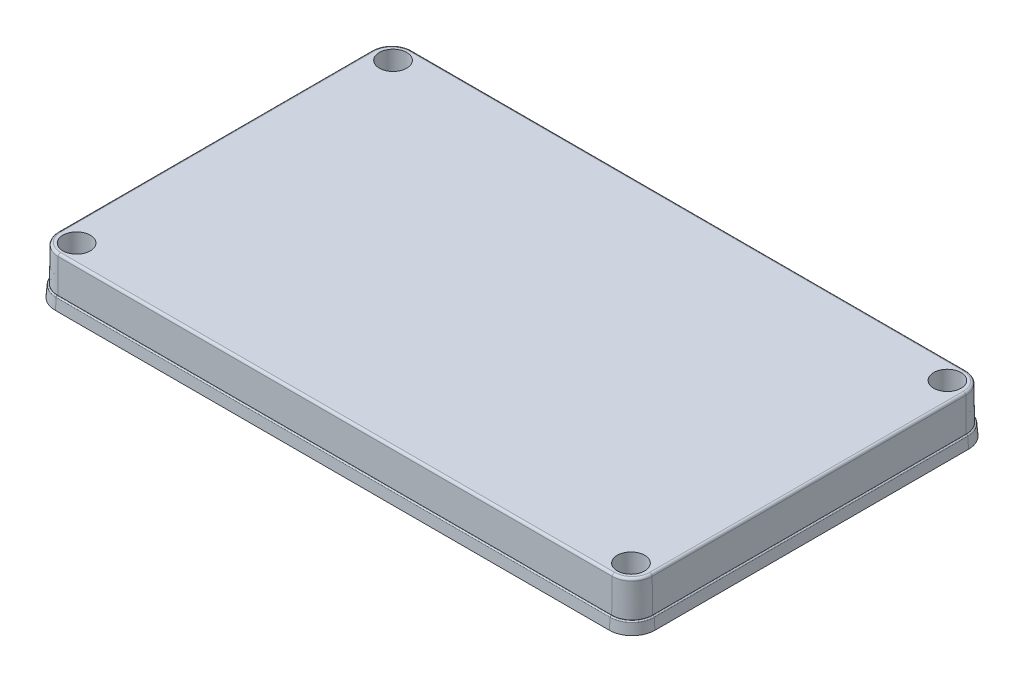
from build123d import *

# Parameters (mm, degrees)
MAIN_BODY_DEPTH                              = 20
TOP_START                                    = -15
TOP_CUT_DEPTH                                = 15
SKETCH3_R                                    = 5.75
COUNTER_BORE_DEPTH                           = 16
CAPTIVE_SCREW_SLIDE_IN_PROFILE_DEPTH         = 11
BOTTOM_START                                 = -2.5
BOTTOM_POCKET_CAPTIVE_SCREW_AREA_DEPTH       = 2.5
CAPTIVE_SCREW_FEATURE_VERTICAL_MIRROR_CO_R   = 5.75
CAPTIVE_SCREW_FEATURE_VERTICAL_MIRRO_2_DEPTH = 16
CAPTIVE_SCREW_FEATURE_VERTICAL_MIRRO_4_DEPTH = 11
CAPTIVE_START                                = -2.5
CAPTIVE_SCREW_FEATURE_VERTICAL_MIRRO_6_DEPTH = 2.5
O_RING_QUARTER_PROFILE_DEPTH                 = 2.7
O_RING_OUTER_FILLETS_R                       = 2
O_RING_INNER_FILLETS_R                       = 1.5
O_RING_OUTER_FILLETS_OF_OQP_HM_R             = 2
O_RING_INNER_FILLETS_OF_OQP_HM_R             = 1.5
OQP_VM_DEPTH                                 = 2.7
LID_POCKET_DEPTH                             = 17
OUTER_TOP_ANGLE                              = 0.795570135
OUTER_BOTTOM_ANGLE                           = -4.39870536
BOTTOM_HALF_OF_LID_R                         = 0.5
TOP_OF_LID_R                                 = 1


# Read off the part's stored shape, not the designer's step: OQP VM
with BuildPart() as part:
    # Sketch1 → MAIN BODY (new body)
    with BuildSketch(Plane(origin=(0, 0, 0), x_dir=(1, 0, 0), z_dir=(0, 1, 0))):
        with BuildLine():
            Line((116.4, -75.5), (-116.4, -75.5))
            ThreePointArc((-116.4, -75.5), (-123.188225099, -72.688225099), (-126, -65.9))
            Line((-126, -65.9), (-126, 65.9))
            ThreePointArc((-126, 65.9), (-123.188225099, 72.688225099), (-116.4, 75.5))
            Line((-116.4, 75.5), (116.4, 75.5))
            ThreePointArc((116.4, 75.5), (123.188225099, 72.688225099), (126, 65.9))
            Line((126, 65.9), (126, -65.9))
            ThreePointArc((126, -65.9), (123.188225099, -72.688225099), (116.4, -75.5))
        make_face()
    extrude(amount=MAIN_BODY_DEPTH)

    # Sketch2 → TOP CUT (cut)
    with BuildSketch(Plane(origin=(0, 20, 0), x_dir=(1, 0, 0), z_dir=(0, 1, 0)).offset(TOP_START)):
        with BuildLine():
            Line((-116.4, -75.5), (116.4, -75.5))
            ThreePointArc((116.4, -75.5), (123.188225099, -72.688225099), (126, -65.9))
            Line((126, -65.9), (126, 65.9))
            ThreePointArc((126, 65.9), (123.188225099, 72.688225099), (116.4, 75.5))
            Line((116.4, 75.5), (-116.4, 75.5))
            ThreePointArc((-116.4, 75.5), (-123.188225099, 72.688225099), (-126, 65.9))
            Line((-126, 65.9), (-126, -65.9))
            ThreePointArc((-126, -65.9), (-123.188225099, -72.688225099), (-116.4, -75.5))
        make_face()
        with BuildLine():
            Line((116.4, 74.5), (-116.4, 74.5))
            ThreePointArc((-116.4, 74.5), (-122.481118318, 71.981118318), (-125, 65.9))
            Line((-125, 65.9), (-125, -65.9))
            ThreePointArc((-125, -65.9), (-122.481118318, -71.981118318), (-116.4, -74.5))
            Line((-116.4, -74.5), (116.4, -74.5))
            ThreePointArc((116.4, -74.5), (122.481118318, -71.981118318), (125, -65.9))
            Line((125, -65.9), (125, 65.9))
            ThreePointArc((125, 65.9), (122.481118318, 71.981118318), (116.4, 74.5))
        make_face(mode=Mode.SUBTRACT)
    extrude(amount=TOP_CUT_DEPTH, mode=Mode.SUBTRACT)

    # Sketch3 → COUNTER BORE (cut)
    with BuildSketch(Plane(origin=(0, 20, 0), x_dir=(1, 0, 0), z_dir=(0, 1, 0))):
        with Locations(Location((-116.5, 66.5, 0), (0, 0, 270))):
            Circle(SKETCH3_R)
    counter_bore = extrude(amount=-COUNTER_BORE_DEPTH, mode=Mode.SUBTRACT)

    # Sketch4 → CAPTIVE SCREW SLIDE IN PROFILE (cut)
    with BuildSketch(Plane(origin=(0, 4, 0), x_dir=(1, 0, 0), z_dir=(0, 1, 0))):
        with BuildLine():
            Line((-120.203714352, 70.15), (-112.796285648, 70.15))
            ThreePointArc((-112.796285648, 70.15), (-111.3, 66.5), (-112.796285648, 62.85))
            Line((-112.796285648, 62.85), (-120.203714352, 62.85))
            ThreePointArc((-120.203714352, 62.85), (-121.7, 66.5), (-120.203714352, 70.15))
        make_face()
    captive_screw_slide_in_profile = extrude(amount=-CAPTIVE_SCREW_SLIDE_IN_PROFILE_DEPTH, mode=Mode.SUBTRACT)

    # Sketch5 → BOTTOM POCKET CAPTIVE SCREW AREA (cut)
    with BuildSketch(Plane(origin=(0, 0, 0), x_dir=(-1, 0, 0), z_dir=(0, -1, 0)).offset(BOTTOM_START)):
        with BuildLine():
            Line((121.7, 61.3), (116.5, 61.3))
            ThreePointArc((116.5, 61.3), (112.823044738, 62.823044738), (111.3, 66.5))
            Line((111.3, 66.5), (111.3, 71.7))
            Line((111.3, 71.7), (116.5, 71.7))
            ThreePointArc((116.5, 71.7), (120.176955262, 70.176955262), (121.7, 66.5))
            Line((121.7, 66.5), (121.7, 61.3))
        make_face()
    bottom_pocket_captive_screw_area = extrude(amount=BOTTOM_POCKET_CAPTIVE_SCREW_AREA_DEPTH, mode=Mode.SUBTRACT)

    # CAPTIVE SCREW FEATURE HORIZONTAL MIRROR: COUNTER BORE, CAPTIVE SCREW SLIDE IN PROFILE, BOTTOM POCKET CAPTIVE SCREW AREA across plane
    add(counter_bore.mirror(Plane(origin=(0, 0, 0), x_dir=(0, 0, 1), z_dir=(1, 0, 0))), mode=Mode.SUBTRACT)
    add(captive_screw_slide_in_profile.mirror(Plane(origin=(0, 0, 0), x_dir=(0, 0, 1), z_dir=(1, 0, 0))), mode=Mode.SUBTRACT)
    add(bottom_pocket_captive_screw_area.mirror(Plane(origin=(0, 0, 0), x_dir=(0, 0, 1), z_dir=(1, 0, 0))), mode=Mode.SUBTRACT)

    # CAPTIVE SCREW FEATURE VERTICAL MIRROR: COUNTER BORE, CAPTIVE SCREW SLIDE IN PROFILE, BOTTOM POCKET CAPTIVE SCREW AREA across plane
    add(counter_bore.mirror(Plane.XY), mode=Mode.SUBTRACT)
    add(captive_screw_slide_in_profile.mirror(Plane.XY), mode=Mode.SUBTRACT)
    add(bottom_pocket_captive_screw_area.mirror(Plane.XY), mode=Mode.SUBTRACT)

    # CAPTIVE SCREW FEATURE VERTICAL MIRROR co → CAPTIVE SCREW FEATURE VERTICAL MIRRO 2 (cut)
    with BuildSketch(Plane(origin=(0, 20, 0), x_dir=(-1, 0, 0), z_dir=(0, 1, 0))):
        with Locations(Location((-116.5, 66.5, 0), (0, 0, 270))):
            Circle(CAPTIVE_SCREW_FEATURE_VERTICAL_MIRROR_CO_R)
    extrude(amount=-CAPTIVE_SCREW_FEATURE_VERTICAL_MIRRO_2_DEPTH, mode=Mode.SUBTRACT)

    # CAPTIVE SCREW FEATURE VERTICAL MIRRO 3 → CAPTIVE SCREW FEATURE VERTICAL MIRRO 4 (cut)
    with BuildSketch(Plane(origin=(0, 4, 0), x_dir=(-1, 0, 0), z_dir=(0, 1, 0))):
        with BuildLine():
            Line((-120.203714352, 70.15), (-112.796285648, 70.15))
            ThreePointArc((-112.796285648, 70.15), (-111.3, 66.5), (-112.796285648, 62.85))
            Line((-112.796285648, 62.85), (-120.203714352, 62.85))
            ThreePointArc((-120.203714352, 62.85), (-121.7, 66.5), (-120.203714352, 70.15))
        make_face()
    extrude(amount=-CAPTIVE_SCREW_FEATURE_VERTICAL_MIRRO_4_DEPTH, mode=Mode.SUBTRACT)

    # CAPTIVE SCREW FEATURE VERTICAL MIRRO 5 → CAPTIVE SCREW FEATURE VERTICAL MIRRO 6 (cut)
    with BuildSketch(Plane.XZ.offset(CAPTIVE_START)):
        with BuildLine():
            Line((121.7, 61.3), (116.5, 61.3))
            ThreePointArc((116.5, 61.3), (112.823044738, 62.823044738), (111.3, 66.5))
            Line((111.3, 66.5), (111.3, 71.7))
            Line((111.3, 71.7), (116.5, 71.7))
            ThreePointArc((116.5, 71.7), (120.176955262, 70.176955262), (121.7, 66.5))
            Line((121.7, 66.5), (121.7, 61.3))
        make_face()
    extrude(amount=CAPTIVE_SCREW_FEATURE_VERTICAL_MIRRO_6_DEPTH, mode=Mode.SUBTRACT)

    # Sketch7 → O-RING QUARTER PROFILE (cut)
    with BuildSketch(Plane.XZ):
        with BuildLine():
            Line((-116.5, 55.3), (-121.3, 55.3))
            Line((-121.3, 55.3), (-121.8, 0))
            Line((-121.8, 0), (-124.8, 0))
            Line((-124.8, 0), (-124.8, 58.3))
            Line((-124.8, 58.3), (-116.5, 58.3))
            ThreePointArc((-116.5, 58.3), (-110.701724394, 60.701724394), (-108.3, 66.5))
            Line((-108.3, 66.5), (-108.3, 74.3))
            Line((-108.3, 74.3), (0, 74.3))
            Line((0, 74.3), (0, 71.3))
            Line((0, 71.3), (-105.3, 71.3))
            Line((-105.3, 71.3), (-105.3, 66.5))
            ThreePointArc((-105.3, 66.5), (-108.580404051, 58.580404051), (-116.5, 55.3))
        make_face()
    o_ring_quarter_profile = extrude(amount=-O_RING_QUARTER_PROFILE_DEPTH, mode=Mode.SUBTRACT)

    # O-RING OUTER FILLETS
    o_ring_outer_fillets_edges = [part.edges().sort_by_distance(p)[0] for p in [
        (-124.8, 1.35, 58.3),
        (-108.3, 1.35, 74.3),
    ]]
    fillet(o_ring_outer_fillets_edges, radius=O_RING_OUTER_FILLETS_R)

    # O-RING INNER FILLETS
    o_ring_inner_fillets_edges = [part.edges().sort_by_distance(p)[0] for p in [
        (-121.3, 1.35, 55.3),
        (-105.3, 1.35, 71.3),
    ]]
    fillet(o_ring_inner_fillets_edges, radius=O_RING_INNER_FILLETS_R)

    # OQP HM: O-RING QUARTER PROFILE across plane
    add(o_ring_quarter_profile.mirror(Plane(origin=(0, 0, 0), x_dir=(0, 0, 1), z_dir=(1, 0, 0))), mode=Mode.SUBTRACT)

    # O-RING OUTER FILLETS of OQP HM
    o_ring_outer_fillets_of_oqp_hm_edges = [part.edges().sort_by_distance(p)[0] for p in [
        (124.8, 1.35, 58.3),
        (108.3, 1.35, 74.3),
    ]]
    fillet(o_ring_outer_fillets_of_oqp_hm_edges, radius=O_RING_OUTER_FILLETS_OF_OQP_HM_R)

    # O-RING INNER FILLETS of OQP HM
    o_ring_inner_fillets_of_oqp_hm_edges = [part.edges().sort_by_distance(p)[0] for p in [
        (121.3, 1.35, 55.3),
        (105.3, 1.35, 71.3),
    ]]
    fillet(o_ring_inner_fillets_of_oqp_hm_edges, radius=O_RING_INNER_FILLETS_OF_OQP_HM_R)

    # OQP VM outline → OQP VM (cut)
    with BuildSketch(Plane(origin=(0, 0, 0), x_dir=(1, 0, 0), z_dir=(0, 1, 0))):
        with BuildLine():
            ThreePointArc((-122.8, 58.3), (-124.214213562, 57.714213562), (-124.8, 56.3))
            Line((-124.8, 56.3), (-124.8, 0))
            Line((-124.8, 0), (-121.8, 0))
            Line((-121.8, 0), (-121.313439766, 53.813561833))
            ThreePointArc((-121.313439766, 53.813561833), (-120.869355528, 54.865444215), (-119.813501075, 55.3))
            Line((-119.813501075, 55.3), (-116.5, 55.3))
            ThreePointArc((-116.5, 55.3), (-108.580404051, 58.580404051), (-105.3, 66.5))
            Line((-105.3, 66.5), (-105.3, 69.8))
            ThreePointArc((-105.3, 69.8), (-104.860660172, 70.860660172), (-103.8, 71.3))
            Line((-103.8, 71.3), (103.8, 71.3))
            ThreePointArc((103.8, 71.3), (104.860660172, 70.860660172), (105.3, 69.8))
            Line((105.3, 69.8), (105.3, 66.5))
            ThreePointArc((105.3, 66.5), (108.580404051, 58.580404051), (116.5, 55.3))
            Line((116.5, 55.3), (119.813501075, 55.3))
            ThreePointArc((119.813501075, 55.3), (120.869355528, 54.865444215), (121.313439766, 53.813561833))
            Line((121.313439766, 53.813561833), (121.8, 0))
            Line((121.8, 0), (124.8, 0))
            Line((124.8, 0), (124.8, 56.3))
            ThreePointArc((124.8, 56.3), (124.214213562, 57.714213562), (122.8, 58.3))
            Line((122.8, 58.3), (116.5, 58.3))
            ThreePointArc((116.5, 58.3), (110.701724394, 60.701724394), (108.3, 66.5))
            Line((108.3, 66.5), (108.3, 72.3))
            ThreePointArc((108.3, 72.3), (107.714213562, 73.714213562), (106.3, 74.3))
            Line((106.3, 74.3), (-106.3, 74.3))
            ThreePointArc((-106.3, 74.3), (-107.714213562, 73.714213562), (-108.3, 72.3))
            Line((-108.3, 72.3), (-108.3, 66.5))
            ThreePointArc((-108.3, 66.5), (-110.701724394, 60.701724394), (-116.5, 58.3))
            Line((-116.5, 58.3), (-122.8, 58.3))
        make_face()
    extrude(amount=OQP_VM_DEPTH, mode=Mode.SUBTRACT)

    # Sketch9 → LID POCKET (cut)
    with BuildSketch(Plane.XZ):
        with BuildLine():
            Line((120.599950951, 0), (120.113488814, 53.802712367))
            ThreePointArc((120.113488814, 53.802712367), (120.024671966, 54.013088843), (119.813501075, 54.1))
            Line((119.813501075, 54.1), (116.5, 54.1))
            ThreePointArc((116.5, 54.1), (107.731875913, 57.731875913), (104.1, 66.5))
            Line((104.1, 66.5), (104.1, 69.8))
            ThreePointArc((104.1, 69.8), (104.012132034, 70.012132034), (103.8, 70.1))
            Line((103.8, 70.1), (-103.8, 70.1))
            ThreePointArc((-103.8, 70.1), (-104.012132034, 70.012132034), (-104.1, 69.8))
            Line((-104.1, 69.8), (-104.1, 66.5))
            ThreePointArc((-104.1, 66.5), (-107.731875913, 57.731875913), (-116.5, 54.1))
            Line((-116.5, 54.1), (-119.813501075, 54.1))
            ThreePointArc((-119.813501075, 54.1), (-120.024671966, 54.013088843), (-120.113488814, 53.802712367))
            Line((-120.113488814, 53.802712367), (-120.599950951, 0))
            Line((-120.599950951, 0), (-120.113488814, -53.802712367))
            ThreePointArc((-120.113488814, -53.802712367), (-120.024671966, -54.013088843), (-119.813501075, -54.1))
            Line((-119.813501075, -54.1), (-116.5, -54.1))
            ThreePointArc((-116.5, -54.1), (-107.731875913, -57.731875913), (-104.1, -66.5))
            Line((-104.1, -66.5), (-104.1, -69.8))
            ThreePointArc((-104.1, -69.8), (-104.012132034, -70.012132034), (-103.8, -70.1))
            Line((-103.8, -70.1), (103.8, -70.1))
            ThreePointArc((103.8, -70.1), (104.012132034, -70.012132034), (104.1, -69.8))
            Line((104.1, -69.8), (104.1, -66.5))
            ThreePointArc((104.1, -66.5), (107.731875913, -57.731875913), (116.5, -54.1))
            Line((116.5, -54.1), (119.813501075, -54.1))
            ThreePointArc((119.813501075, -54.1), (120.024671966, -54.013088843), (120.113488814, -53.802712367))
            Line((120.113488814, -53.802712367), (120.599950951, 0))
        make_face()
    extrude(amount=-LID_POCKET_DEPTH, mode=Mode.SUBTRACT)

    # OUTER TOP
    outer_top_faces = [part.faces().sort_by_distance(p)[0] for p in [
        (122.481118318, 12.5, 71.981118318),
        (0, 12.5, 74.5),
        (-122.481118318, 12.5, 71.981118318),
        (-125, 12.5, 0),
        (-122.481118318, 12.5, -71.981118318),
        (0, 12.5, -74.5),
        (122.481118318, 12.5, -71.981118318),
        (125, 12.5, 0),
    ]]
    draft(outer_top_faces, Plane(origin=(-116.4, 5, 65.9), x_dir=(0, 0, 1), z_dir=(0, 1, 0)), OUTER_TOP_ANGLE)

    # OUTER BOTTOM
    outer_bottom_faces = [part.faces().sort_by_distance(p)[0] for p in [
        (126, 2.5, 0),
        (123.188225099, 2.5, 72.688225099),
        (0, 2.5, 75.5),
        (-123.188225099, 2.5, 72.688225099),
        (-126, 2.5, 0),
        (-123.188225099, 2.5, -72.688225099),
        (0, 2.5, -75.5),
        (123.188225099, 2.5, -72.688225099),
    ]]
    draft(outer_bottom_faces, Plane(origin=(-116.4, 0, 65.9), x_dir=(0, 0, -1), z_dir=(0, -1, 0)), OUTER_BOTTOM_ANGLE)

    # BOTTOM HALF OF LID
    bottom_half_of_lid_edges = [part.edges().sort_by_distance(p)[0] for p in [
        (-122.916260952, 5, 72.416260952),
        (-125.615384615, 5, 0),
        (-122.916260952, 5, -72.416260952),
        (0, 5, -75.115384615),
        (122.916260952, 5, -72.416260952),
        (125.615384615, 5, 0),
        (122.916260952, 5, 72.416260952),
        (0, 5, 75.115384615),
    ]]
    fillet(bottom_half_of_lid_edges, radius=BOTTOM_HALF_OF_LID_R)

    # TOP OF LID
    top_of_lid_edges = [part.edges().sort_by_distance(p)[0] for p in [
        (122.333832812, 20, -71.833832812),
        (124.791706839, 20, 0),
        (122.333832812, 20, 71.833832812),
        (0, 20, 74.291706839),
        (-122.333832812, 20, 71.833832812),
        (-124.791706839, 20, 0),
        (-122.333832812, 20, -71.833832812),
        (0, 20, -74.291706839),
    ]]
    fillet(top_of_lid_edges, radius=TOP_OF_LID_R)


solid = part.part
